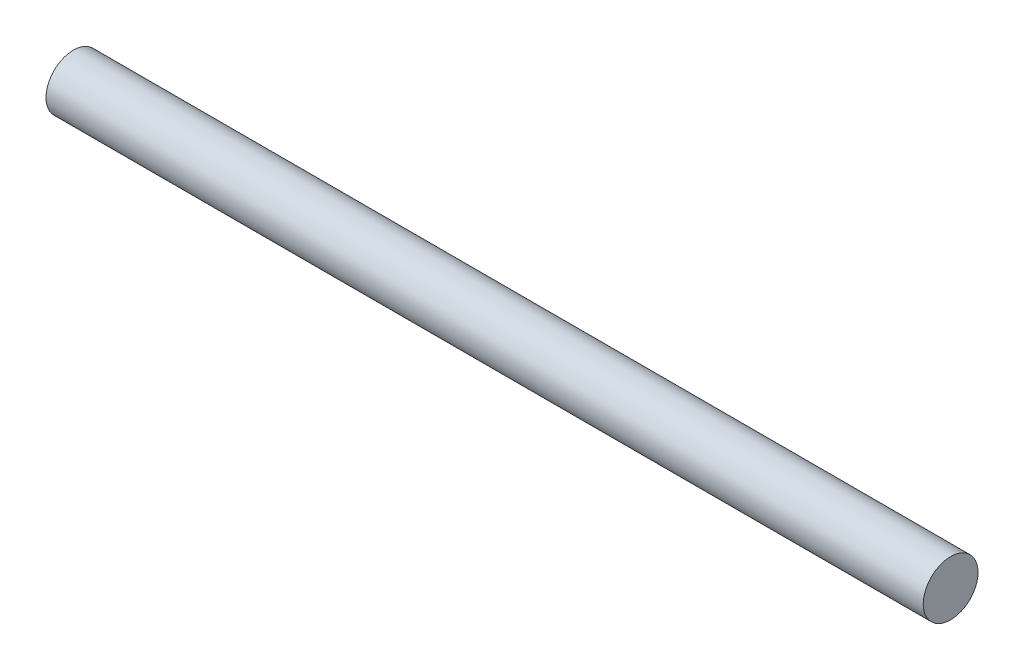
from build123d import *

# Parameters (mm, degrees)
SKETCH1_R           = 4.7625
BOSS_EXTRUDE1_DEPTH = 76.2


with BuildPart() as part:
    # Sketch1 → Boss-Extrude1 (new, symmetric)
    with BuildSketch(Plane(origin=(0, 0, 0), x_dir=(0, 0, -1), z_dir=(1, 0, 0))):
        Circle(SKETCH1_R)
    extrude(amount=BOSS_EXTRUDE1_DEPTH, both=True)


solid = part.part
